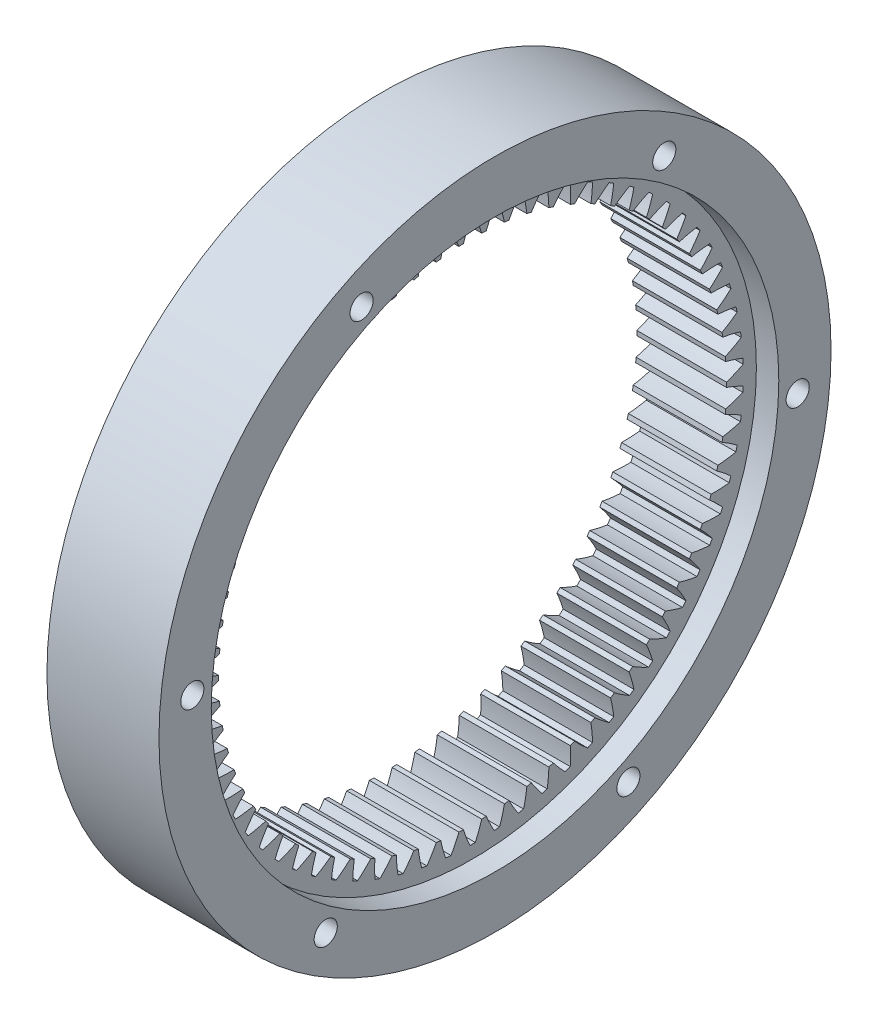
from build123d import *

# Parameters (mm, degrees)
INTERNAL_START                  = -34.130495749
INTERNAL_SPUR_GEAR_AM_OUTLINE_R = 42
INTERNAL_SPUR_GEAR_AM_DEPTH     = 12
SKETCH1_R                       = 42
SKETCH1_R_2                     = 38
BOSS_EXTRUDE1_DEPTH             = 3
SKETCH3_R                       = 45
SKETCH3_R_2                     = 42
BOSS_EXTRUDE2_DEPTH             = 15
SKETCH5_R                       = 1.55
CUT_EXTRUDE3_DEPTH              = 23
SKETCH6_R                       = 3.5
CUT_EXTRUDE4_DEPTH              = 6


# Read off the part's stored shape, not the designer's step: internal spur gear_am
with BuildPart() as part:
    # internal spur gear_am outline → internal spur gear_am (new body)
    with BuildSketch(Plane.YZ.offset(INTERNAL_START)):
        with Locations((5.209024111, 14.471263334)):
            Circle(INTERNAL_SPUR_GEAR_AM_OUTLINE_R)
        with BuildLine():
            ThreePointArc((41.458248738, 14.112494719), (40.337646202, 13.643140222), (39.187179195, 13.252666979))
            ThreePointArc((39.187179195, 13.252666979), (39.174788373, 12.945859102), (39.159627267, 12.639175639))
            ThreePointArc((39.159627267, 12.639175639), (40.27046108, 12.147147259), (41.344479787, 11.579232209))
            ThreePointArc((41.344479787, 11.579232209), (41.314088242, 11.221748747), (41.280160246, 10.864583572))
            ThreePointArc((41.280160246, 10.864583572), (40.121996313, 10.497568596), (38.941158997, 10.21179435))
            ThreePointArc((38.941158997, 10.21179435), (38.901316011, 9.907332296), (38.858725045, 9.603242482))
            ThreePointArc((38.858725045, 9.603242482), (39.920981884, 9.013620488), (40.939769395, 8.351717402))
            ThreePointArc((40.939769395, 8.351717402), (40.877455627, 7.998397341), (40.811648175, 7.64571129))
            ThreePointArc((40.811648175, 7.64571129), (39.625247701, 7.383990822), (38.423547483, 7.205216461))
            ThreePointArc((38.423547483, 7.205216461), (38.356573125, 6.90555158), (38.286895217, 6.606503766))
            ThreePointArc((38.286895217, 6.606503766), (39.292022414, 5.924035448), (40.247376051, 5.173473581))
            ThreePointArc((40.247376051, 5.173473581), (40.153641774, 4.827161646), (40.05648471, 4.48179434))
            ThreePointArc((40.05648471, 4.48179434), (38.851399893, 4.3274756), (37.638512156, 4.257140509))
            ThreePointArc((37.638512156, 4.257140509), (37.544945665, 3.964685525), (37.44874182, 3.67308747))
            ThreePointArc((37.44874182, 3.67308747), (38.388646682, 2.903267661), (39.272874499, 2.070090096))
            ThreePointArc((39.272874499, 2.070090096), (39.148474406, 1.733574587), (39.020749981, 1.39830672))
            ThreePointArc((39.020749981, 1.39830672), (37.806683457, 1.352632192), (36.59237366, 1.391302668))
            ThreePointArc((36.59237366, 1.391302668), (36.472968377, 1.108412258), (36.351013173, 0.826611737))
            ThreePointArc((36.351013173, 0.826611737), (37.218128139, -0.024361426), (38.024110854, -0.933446434))
            ThreePointArc((38.024110854, -0.933446434), (37.870046541, -1.257456092), (37.712783117, -1.57992514))
            ThreePointArc((37.712783117, -1.57992514), (36.499509835, -1.516587711), (35.293554887, -1.369223021))
            ThreePointArc((35.293554887, -1.369223021), (35.149272194, -1.64027119), (35.002547542, -1.910005285))
            ThreePointArc((35.002547542, -1.910005285), (35.789891111, -2.835280266), (36.511139424, -3.812953299))
            ThreePointArc((36.511139424, -3.812953299), (36.328651327, -4.121848371), (36.143115098, -4.428922268))
            ThreePointArc((36.143115098, -4.428922268), (34.94040362, -4.257082839), (33.752513161, -4.002210427))
            ThreePointArc((33.752513161, -4.002210427), (33.584514737, -4.259234035), (33.414201977, -4.514729963))
            ThreePointArc((33.414201977, -4.514729963), (34.115434923, -5.506856993), (34.746141768, -6.545246402))
            ThreePointArc((34.746141768, -6.545246402), (34.536699174, -6.836539847), (34.324383966, -7.125746215))
            ThreePointArc((34.324383966, -7.125746215), (33.141917819, -6.846788335), (31.981656045, -6.486460285))
            ThreePointArc((31.981656045, -6.486460285), (31.791294515, -6.727389929), (31.598764905, -6.966590588))
            ThreePointArc((31.598764905, -6.966590588), (32.208241312, -8.017581643), (32.743328608, -9.108326926))
            ThreePointArc((32.743328608, -9.108326926), (32.508617825, -9.37967342), (32.271233077, -9.64868374))
            ThreePointArc((32.271233077, -9.64868374), (31.118532782, -9.264853414), (29.995241438, -8.801970875))
            ThreePointArc((29.995241438, -8.801970875), (29.784049481, -9.024866731), (29.570853158, -9.245846217))
            ThreePointArc((29.570853158, -9.245846217), (30.08366588, -10.347239335), (30.518825418, -11.481558455))
            ThreePointArc((30.518825418, -11.481558455), (30.260736199, -11.730773274), (30.000193193, -11.977421634))
            ThreePointArc((30.000193193, -11.977421634), (28.886539616, -11.491809238), (27.809262784, -10.930099068))
            ThreePointArc((27.809262784, -10.930099068), (27.578940793, -11.13316651), (27.346794287, -11.334145627))
            ThreePointArc((27.346794287, -11.334145627), (27.758814458, -12.477073038), (28.090542589, -13.645833122))
            ThreePointArc((28.090542589, -13.645833122), (27.811152918, -13.870909737), (27.529549393, -14.093210267))
            ThreePointArc((27.529549393, -14.093210267), (26.463909018, -13.509725667), (25.441320296, -12.853710427))
            ThreePointArc((25.441320296, -12.853710427), (25.193722688, -13.035314475), (24.944495107, -13.214675056))
            ThreePointArc((24.944495107, -13.214675056), (25.252405383, -14.389934581), (25.478031228, -15.583725461))
            ThreePointArc((25.478031228, -15.583725461), (25.179590585, -15.782851686), (24.879193847, -15.979014555))
            ThreePointArc((24.879193847, -15.979014555), (23.870146583, -15.302355626), (22.910479256, -14.557317164))
            ThreePointArc((22.910479256, -14.557317164), (22.647599542, -14.715995648), (22.383297519, -14.872293589))
            ThreePointArc((22.383297519, -14.872293589), (22.584618787, -16.070422728), (22.70232574, -17.279632702))
            ThreePointArc((22.70232574, -17.279632702), (22.387236994, -17.451205291), (22.070465661, -17.61965111))
            ThreePointArc((22.070465661, -17.61965111), (21.126135763, -16.855265911), (20.237116508, -16.027202839))
            ThreePointArc((20.237116508, -16.027202839), (19.96107124, -16.161678174), (19.68382278, -16.293655055))
            ThreePointArc((19.68382278, -16.293655055), (19.77693412, -17.505007178), (19.785774473, -18.719900398))
            ThreePointArc((19.785774473, -18.719900398), (19.456574534, -18.862537949), (19.125979062, -19.00191049))
            ThreePointArc((19.125979062, -19.00191049), (18.25396972, -18.155953402), (17.442756396, -17.251532797))
            ThreePointArc((17.442756396, -17.251532797), (17.155768129, -17.360722267), (16.867805474, -17.467315487))
            ThreePointArc((16.867805474, -17.467315487), (16.851957207, -18.682137499), (16.751859783, -19.892932359))
            ThreePointArc((16.751859783, -19.892932359), (16.411199174, -20.005486438), (16.069441324, -20.114663557))
            ThreePointArc((16.069441324, -20.114663557), (15.276773444, -19.193945729), (14.549897465, -18.220449453))
            ThreePointArc((14.549897465, -18.220449453), (14.25427686, -18.303473929), (13.957918515, -18.383825263))
            ThreePointArc((13.957918515, -18.383825263), (13.833238243, -19.592336131), (13.625008967, -20.789284023))
            ThreePointArc((13.625008967, -20.789284023), (13.275630487, -20.87084841), (12.925461893, -20.948951077))
            ThreePointArc((12.925461893, -20.948951077), (12.218517571, -19.960885587), (11.581831313, -18.926151661))
            ThreePointArc((11.581831313, -18.926151661), (11.279958533, -18.982342678), (10.977590602, -19.035805183))
            ThreePointArc((10.977590602, -19.035805183), (10.745082178, -20.228274688), (10.430397589, -21.401738492))
            ThreePointArc((10.430397589, -21.401738492), (10.07511423, -21.45165648), (9.719354242, -21.498055857))
            ThreePointArc((9.719354242, -21.498055857), (9.103825377, -20.450598028), (8.562455066, -19.36295752))
            ThreePointArc((8.562455066, -19.36295752), (8.256760613, -19.391862662), (7.950817584, -19.41800589))
            ThreePointArc((7.950817584, -19.41800589), (7.612353028, -20.584832969), (7.193746783, -21.725364643))
            ThreePointArc((7.193746783, -21.725364643), (6.835419076, -21.743234321), (6.476932065, -21.757556829))
            ThreePointArc((6.476932065, -21.757556829), (5.957774534, -20.659140175), (5.516078964, -19.527350127))
            ThreePointArc((5.516078964, -19.527350127), (5.20902411, -19.528736666), (4.901969257, -19.527350127))
            ThreePointArc((4.901969257, -19.527350127), (4.460273687, -20.659140175), (3.941116156, -21.757556829))
            ThreePointArc((3.941116156, -21.757556829), (3.582629145, -21.743234321), (3.224301438, -21.725364643))
            ThreePointArc((3.224301438, -21.725364643), (2.805695193, -20.584832969), (2.467230637, -19.41800589))
            ThreePointArc((2.467230637, -19.41800589), (2.161287608, -19.391862662), (1.855593155, -19.36295752))
            ThreePointArc((1.855593155, -19.36295752), (1.314222844, -20.450598028), (0.698693979, -21.498055857))
            ThreePointArc((0.698693979, -21.498055857), (0.342933991, -21.45165648), (-0.012349368, -21.401738492))
            ThreePointArc((-0.012349368, -21.401738492), (-0.327033957, -20.228274688), (-0.559542381, -19.035805183))
            ThreePointArc((-0.559542381, -19.035805183), (-0.861910312, -18.982342678), (-1.163783092, -18.926151661))
            ThreePointArc((-1.163783092, -18.926151661), (-1.800469349, -19.960885587), (-2.507413672, -20.948951077))
            ThreePointArc((-2.507413672, -20.948951077), (-2.857582266, -20.87084841), (-3.206960746, -20.789284023))
            ThreePointArc((-3.206960746, -20.789284023), (-3.415190022, -19.592336131), (-3.539870293, -18.383825263))
            ThreePointArc((-3.539870293, -18.383825263), (-3.836228638, -18.303473929), (-4.131849243, -18.220449453))
            ThreePointArc((-4.131849243, -18.220449453), (-4.858725223, -19.193945729), (-5.651393103, -20.114663557))
            ThreePointArc((-5.651393103, -20.114663557), (-5.993150952, -20.005486438), (-6.333811561, -19.892932359))
            ThreePointArc((-6.333811561, -19.892932359), (-6.433908986, -18.682137499), (-6.449757252, -17.467315487))
            ThreePointArc((-6.449757252, -17.467315487), (-6.737719908, -17.360722267), (-7.024708175, -17.251532797))
            ThreePointArc((-7.024708175, -17.251532797), (-7.835921498, -18.155953402), (-8.70793084, -19.00191049))
            ThreePointArc((-8.70793084, -19.00191049), (-9.038526312, -18.862537949), (-9.367726251, -18.719900398))
            ThreePointArc((-9.367726251, -18.719900398), (-9.358885899, -17.505007178), (-9.265774559, -16.293655055))
            ThreePointArc((-9.265774559, -16.293655055), (-9.543023019, -16.161678174), (-9.819068287, -16.027202839))
            ThreePointArc((-9.819068287, -16.027202839), (-10.708087542, -16.855265911), (-11.65241744, -17.61965111))
            ThreePointArc((-11.65241744, -17.61965111), (-11.969188773, -17.451205291), (-12.284277519, -17.279632702))
            ThreePointArc((-12.284277519, -17.279632702), (-12.166570566, -16.070422728), (-11.965249298, -14.872293589))
            ThreePointArc((-11.965249298, -14.872293589), (-12.229551321, -14.715995648), (-12.492431035, -14.557317164))
            ThreePointArc((-12.492431035, -14.557317164), (-13.452098362, -15.302355626), (-14.461145626, -15.979014555))
            ThreePointArc((-14.461145626, -15.979014555), (-14.761542364, -15.782851686), (-15.059983007, -15.583725461))
            ThreePointArc((-15.059983007, -15.583725461), (-14.834357162, -14.389934581), (-14.526446886, -13.214675056))
            ThreePointArc((-14.526446886, -13.214675056), (-14.775674467, -13.035314474), (-15.023272075, -12.853710427))
            ThreePointArc((-15.023272075, -12.853710427), (-16.045860796, -13.509725667), (-17.111501172, -14.093210267))
            ThreePointArc((-17.111501172, -14.093210267), (-17.393104697, -13.870909737), (-17.672494368, -13.645833122))
            ThreePointArc((-17.672494368, -13.645833122), (-17.340766237, -12.477073037), (-16.928746065, -11.334145627))
            ThreePointArc((-16.928746065, -11.334145627), (-17.160892571, -11.13316651), (-17.391214563, -10.930099068))
            ThreePointArc((-17.391214563, -10.930099068), (-18.468491395, -11.491809238), (-19.582144972, -11.977421634))
            ThreePointArc((-19.582144972, -11.977421634), (-19.842687977, -11.730773274), (-20.100777196, -11.481558455))
            ThreePointArc((-20.100777196, -11.481558455), (-19.665617659, -10.347239335), (-19.152804936, -9.245846217))
            ThreePointArc((-19.152804936, -9.245846217), (-19.366001259, -9.024866731), (-19.577193217, -8.801970875))
            ThreePointArc((-19.577193217, -8.801970875), (-20.700484561, -9.264853414), (-21.853184855, -9.64868374))
            ThreePointArc((-21.853184855, -9.64868374), (-22.090569603, -9.37967342), (-22.325280386, -9.108326926))
            ThreePointArc((-22.325280386, -9.108326926), (-21.790193091, -8.017581643), (-21.180716684, -6.966590588))
            ThreePointArc((-21.180716684, -6.966590588), (-21.373246293, -6.727389929), (-21.563607824, -6.486460285))
            ThreePointArc((-21.563607824, -6.486460285), (-22.723869598, -6.846788335), (-23.906335745, -7.125746215))
            ThreePointArc((-23.906335745, -7.125746215), (-24.118650953, -6.836539846), (-24.328093547, -6.545246402))
            ThreePointArc((-24.328093547, -6.545246402), (-23.697386702, -5.506856993), (-22.996153756, -4.514729963))
            ThreePointArc((-22.996153756, -4.514729963), (-23.166466516, -4.259234035), (-23.33446494, -4.002210427))
            ThreePointArc((-23.33446494, -4.002210427), (-24.522355398, -4.257082839), (-25.725066876, -4.428922268))
            ThreePointArc((-25.725066876, -4.428922268), (-25.910603106, -4.121848371), (-26.093091203, -3.812953299))
            ThreePointArc((-26.093091203, -3.812953299), (-25.37184289, -2.835280266), (-24.58449932, -1.910005285))
            ThreePointArc((-24.58449932, -1.910005285), (-24.731223972, -1.64027119), (-24.875506666, -1.369223021))
            ThreePointArc((-24.875506666, -1.369223021), (-26.081461614, -1.516587711), (-27.294734896, -1.57992514))
            ThreePointArc((-27.294734896, -1.57992514), (-27.45199832, -1.257456092), (-27.606062632, -0.933446434))
            ThreePointArc((-27.606062632, -0.933446434), (-26.800079918, -0.024361426), (-25.932964952, 0.826611737))
            ThreePointArc((-25.932964952, 0.826611737), (-26.054920156, 1.108412258), (-26.174325439, 1.391302668))
            ThreePointArc((-26.174325439, 1.391302668), (-27.388635236, 1.352632192), (-28.60270176, 1.39830672))
            ThreePointArc((-28.60270176, 1.39830672), (-28.730426185, 1.733574587), (-28.854826278, 2.070090096))
            ThreePointArc((-28.854826278, 2.070090096), (-27.970598461, 2.903267661), (-27.030693599, 3.67308747))
            ThreePointArc((-27.030693599, 3.67308747), (-27.126897443, 3.964685526), (-27.220463935, 4.257140509))
            ThreePointArc((-27.220463935, 4.257140509), (-28.433351672, 4.3274756), (-29.638436488, 4.48179434))
            ThreePointArc((-29.638436488, 4.48179434), (-29.735593552, 4.827161646), (-29.82932783, 5.173473581))
            ThreePointArc((-29.82932783, 5.173473581), (-28.873974193, 5.924035448), (-27.868846996, 6.606503766))
            ThreePointArc((-27.868846996, 6.606503766), (-27.938524904, 6.90555158), (-28.005499261, 7.205216461))
            ThreePointArc((-28.005499261, 7.205216461), (-29.20719948, 7.383990822), (-30.393599954, 7.64571129))
            ThreePointArc((-30.393599954, 7.64571129), (-30.459407406, 7.998397341), (-30.521721174, 8.351717402))
            ThreePointArc((-30.521721174, 8.351717402), (-29.502933663, 9.013620488), (-28.440676824, 9.603242482))
            ThreePointArc((-28.440676824, 9.603242482), (-28.483267789, 9.907332296), (-28.523110775, 10.21179435))
            ThreePointArc((-28.523110775, 10.21179435), (-29.703948092, 10.497568596), (-30.862112025, 10.864583572))
            ThreePointArc((-30.862112025, 10.864583572), (-30.896040021, 11.221748747), (-30.926431566, 11.579232209))
            ThreePointArc((-30.926431566, 11.579232209), (-29.852412859, 12.147147259), (-28.741579046, 12.639175639))
            ThreePointArc((-28.741579046, 12.639175639), (-28.756740152, 12.945859102), (-28.769130974, 13.252666979))
            ThreePointArc((-28.769130974, 13.252666979), (-29.919597981, 13.643140222), (-31.040200517, 14.112494719))
            ThreePointArc((-31.040200517, 14.112494719), (-31.041975889, 14.471263334), (-31.040200517, 14.830031949))
            ThreePointArc((-31.040200517, 14.830031949), (-29.919597981, 15.299386446), (-28.769130974, 15.68985969))
            ThreePointArc((-28.769130974, 15.68985969), (-28.756740152, 15.996667566), (-28.741579046, 16.303351029))
            ThreePointArc((-28.741579046, 16.303351029), (-29.852412859, 16.79537941), (-30.926431566, 17.36329446))
            ThreePointArc((-30.926431566, 17.36329446), (-30.896040021, 17.720777921), (-30.862112025, 18.077943096))
            ThreePointArc((-30.862112025, 18.077943096), (-29.703948092, 18.444958073), (-28.523110775, 18.730732319))
            ThreePointArc((-28.523110775, 18.730732319), (-28.483267789, 19.035194372), (-28.440676824, 19.339284186))
            ThreePointArc((-28.440676824, 19.339284186), (-29.502933663, 19.928906181), (-30.521721174, 20.590809267))
            ThreePointArc((-30.521721174, 20.590809267), (-30.459407406, 20.944129328), (-30.393599954, 21.296815378))
            ThreePointArc((-30.393599954, 21.296815378), (-29.20719948, 21.558535846), (-28.005499261, 21.737310208))
            ThreePointArc((-28.005499261, 21.737310208), (-27.938524904, 22.036975089), (-27.868846996, 22.336022902))
            ThreePointArc((-27.868846996, 22.336022902), (-28.873974193, 23.018491221), (-29.82932783, 23.769053088))
            ThreePointArc((-29.82932783, 23.769053088), (-29.735593552, 24.115365023), (-29.638436488, 24.460732329))
            ThreePointArc((-29.638436488, 24.460732329), (-28.433351672, 24.615051068), (-27.220463935, 24.68538616))
            ThreePointArc((-27.220463935, 24.68538616), (-27.126897443, 24.977841143), (-27.030693599, 25.269439198))
            ThreePointArc((-27.030693599, 25.269439198), (-27.970598461, 26.039259007), (-28.854826278, 26.872436573))
            ThreePointArc((-28.854826278, 26.872436573), (-28.730426185, 27.208952082), (-28.60270176, 27.544219949))
            ThreePointArc((-28.60270176, 27.544219949), (-27.388635236, 27.589894476), (-26.174325439, 27.551224001))
            ThreePointArc((-26.174325439, 27.551224001), (-26.054920156, 27.834114411), (-25.932964952, 28.115914932))
            ThreePointArc((-25.932964952, 28.115914932), (-26.800079918, 28.966888095), (-27.606062632, 29.875973103))
            ThreePointArc((-27.606062632, 29.875973103), (-27.45199832, 30.199982761), (-27.294734896, 30.522451809))
            ThreePointArc((-27.294734896, 30.522451809), (-26.081461614, 30.45911438), (-24.875506666, 30.311749689))
            ThreePointArc((-24.875506666, 30.311749689), (-24.731223972, 30.582797858), (-24.58449932, 30.852531953))
            ThreePointArc((-24.58449932, 30.852531953), (-25.37184289, 31.777806935), (-26.093091203, 32.755479967))
            ThreePointArc((-26.093091203, 32.755479967), (-25.910603106, 33.064375039), (-25.725066876, 33.371448937))
            ThreePointArc((-25.725066876, 33.371448937), (-24.522355399, 33.199609507), (-23.33446494, 32.944737096))
            ThreePointArc((-23.33446494, 32.944737096), (-23.166466516, 33.201760704), (-22.996153756, 33.457256632))
            ThreePointArc((-22.996153756, 33.457256632), (-23.697386702, 34.449383662), (-24.328093547, 35.487773071))
            ThreePointArc((-24.328093547, 35.487773071), (-24.118650952, 35.779066515), (-23.906335745, 36.068272884))
            ThreePointArc((-23.906335745, 36.068272884), (-22.723869598, 35.789315004), (-21.563607824, 35.428986954))
            ThreePointArc((-21.563607824, 35.428986954), (-21.373246293, 35.669916597), (-21.180716684, 35.909117256))
            ThreePointArc((-21.180716684, 35.909117256), (-21.790193091, 36.960108311), (-22.325280386, 38.050853595))
            ThreePointArc((-22.325280386, 38.050853595), (-22.090569603, 38.322200088), (-21.853184855, 38.591210409))
            ThreePointArc((-21.853184855, 38.591210409), (-20.700484561, 38.207380083), (-19.577193217, 37.744497544))
            ThreePointArc((-19.577193217, 37.744497544), (-19.366001259, 37.9673934), (-19.152804936, 38.188372886))
            ThreePointArc((-19.152804936, 38.188372886), (-19.665617659, 39.289766003), (-20.100777196, 40.424085123))
            ThreePointArc((-20.100777196, 40.424085123), (-19.842687978, 40.673299943), (-19.582144972, 40.919948302))
            ThreePointArc((-19.582144972, 40.919948302), (-18.468491395, 40.434335906), (-17.391214563, 39.872625737))
            ThreePointArc((-17.391214563, 39.872625737), (-17.160892571, 40.075693178), (-16.928746065, 40.276672295))
            ThreePointArc((-16.928746065, 40.276672295), (-17.340766237, 41.419599706), (-17.672494368, 42.58835979))
            ThreePointArc((-17.672494368, 42.58835979), (-17.393104697, 42.813436405), (-17.111501172, 43.035736936))
            ThreePointArc((-17.111501172, 43.035736936), (-16.045860796, 42.452252336), (-15.023272075, 41.796237095))
            ThreePointArc((-15.023272075, 41.796237095), (-14.775674467, 41.977841143), (-14.526446886, 42.157201724))
            ThreePointArc((-14.526446886, 42.157201724), (-14.834357162, 43.332461249), (-15.059983007, 44.526252129))
            ThreePointArc((-15.059983007, 44.526252129), (-14.761542364, 44.725378355), (-14.461145626, 44.921541223))
            ThreePointArc((-14.461145626, 44.921541223), (-13.452098362, 44.244882294), (-12.492431035, 43.499843832))
            ThreePointArc((-12.492431035, 43.499843832), (-12.229551321, 43.658522317), (-11.965249298, 43.814820257))
            ThreePointArc((-11.965249298, 43.814820257), (-12.166570566, 45.012949397), (-12.284277519, 46.222159371))
            ThreePointArc((-12.284277519, 46.222159371), (-11.969188773, 46.39373196), (-11.65241744, 46.562177778))
            ThreePointArc((-11.65241744, 46.562177778), (-10.708087542, 45.797792579), (-9.819068287, 44.969729507))
            ThreePointArc((-9.819068287, 44.969729507), (-9.543023019, 45.104204843), (-9.265774559, 45.236181723))
            ThreePointArc((-9.265774559, 45.236181723), (-9.358885899, 46.447533846), (-9.367726251, 47.662427066))
            ThreePointArc((-9.367726251, 47.662427066), (-9.038526312, 47.805064617), (-8.70793084, 47.944437159))
            ThreePointArc((-8.70793084, 47.944437159), (-7.835921498, 47.098480071), (-7.024708175, 46.194059465))
            ThreePointArc((-7.024708175, 46.194059465), (-6.737719908, 46.303248936), (-6.449757252, 46.409842156))
            ThreePointArc((-6.449757252, 46.409842156), (-6.433908986, 47.624664168), (-6.333811561, 48.835459028))
            ThreePointArc((-6.333811561, 48.835459028), (-5.993150952, 48.948013106), (-5.651393103, 49.057190226))
            ThreePointArc((-5.651393103, 49.057190226), (-4.858725223, 48.136472397), (-4.131849243, 47.162976122))
            ThreePointArc((-4.131849243, 47.162976122), (-3.836228638, 47.246000598), (-3.539870293, 47.326351931))
            ThreePointArc((-3.539870293, 47.326351931), (-3.415190022, 48.534862799), (-3.206960746, 49.731810691))
            ThreePointArc((-3.206960746, 49.731810691), (-2.857582267, 49.813375079), (-2.507413672, 49.891477746))
            ThreePointArc((-2.507413672, 49.891477746), (-1.800469349, 48.903412256), (-1.163783092, 47.868678329))
            ThreePointArc((-1.163783092, 47.868678329), (-0.861910313, 47.924869347), (-0.559542381, 47.978331852))
            ThreePointArc((-0.559542381, 47.978331852), (-0.327033957, 49.170801357), (-0.012349368, 50.34426516))
            ThreePointArc((-0.012349368, 50.34426516), (0.342933991, 50.394183148), (0.698693979, 50.440582526))
            ThreePointArc((0.698693979, 50.440582526), (1.314222844, 49.393124697), (1.855593155, 48.305484189))
            ThreePointArc((1.855593155, 48.305484189), (2.161287608, 48.33438933), (2.467230637, 48.360532558))
            ThreePointArc((2.467230637, 48.360532558), (2.805695193, 49.527359637), (3.224301438, 50.667891311))
            ThreePointArc((3.224301438, 50.667891311), (3.582629145, 50.685760989), (3.941116156, 50.700083497))
            ThreePointArc((3.941116156, 50.700083497), (4.460273687, 49.601666843), (4.901969257, 48.469876796))
            ThreePointArc((4.901969257, 48.469876796), (5.209024111, 48.471263334), (5.516078964, 48.469876796))
            ThreePointArc((5.516078964, 48.469876796), (5.957774534, 49.601666843), (6.476932065, 50.700083497))
            ThreePointArc((6.476932065, 50.700083497), (6.835419076, 50.685760989), (7.193746783, 50.667891311))
            ThreePointArc((7.193746783, 50.667891311), (7.612353028, 49.527359637), (7.950817584, 48.360532558))
            ThreePointArc((7.950817584, 48.360532558), (8.256760613, 48.33438933), (8.562455066, 48.305484189))
            ThreePointArc((8.562455066, 48.305484189), (9.103825377, 49.393124697), (9.719354242, 50.440582526))
            ThreePointArc((9.719354242, 50.440582526), (10.07511423, 50.394183148), (10.430397589, 50.34426516))
            ThreePointArc((10.430397589, 50.34426516), (10.745082178, 49.170801357), (10.977590602, 47.978331852))
            ThreePointArc((10.977590602, 47.978331852), (11.279958534, 47.924869347), (11.581831313, 47.868678329))
            ThreePointArc((11.581831313, 47.868678329), (12.218517571, 48.903412255), (12.925461893, 49.891477746))
            ThreePointArc((12.925461893, 49.891477746), (13.275630488, 49.813375079), (13.625008967, 49.731810691))
            ThreePointArc((13.625008967, 49.731810691), (13.833238243, 48.534862799), (13.957918515, 47.326351931))
            ThreePointArc((13.957918515, 47.326351931), (14.25427686, 47.246000598), (14.549897465, 47.162976122))
            ThreePointArc((14.549897465, 47.162976122), (15.276773444, 48.136472397), (16.069441324, 49.057190226))
            ThreePointArc((16.069441324, 49.057190226), (16.411199174, 48.948013106), (16.751859783, 48.835459028))
            ThreePointArc((16.751859783, 48.835459028), (16.851957207, 47.624664168), (16.867805474, 46.409842156))
            ThreePointArc((16.867805474, 46.409842156), (17.15576813, 46.303248936), (17.442756396, 46.194059465))
            ThreePointArc((17.442756396, 46.194059465), (18.25396972, 47.098480071), (19.125979062, 47.944437159))
            ThreePointArc((19.125979062, 47.944437159), (19.456574533, 47.805064617), (19.785774473, 47.662427066))
            ThreePointArc((19.785774473, 47.662427066), (19.77693412, 46.447533846), (19.68382278, 45.236181723))
            ThreePointArc((19.68382278, 45.236181723), (19.961071241, 45.104204843), (20.237116508, 44.969729507))
            ThreePointArc((20.237116508, 44.969729507), (21.126135763, 45.797792579), (22.070465661, 46.562177778))
            ThreePointArc((22.070465661, 46.562177778), (22.387236994, 46.39373196), (22.70232574, 46.222159371))
            ThreePointArc((22.70232574, 46.222159371), (22.584618787, 45.012949397), (22.383297519, 43.814820257))
            ThreePointArc((22.383297519, 43.814820257), (22.647599542, 43.658522317), (22.910479256, 43.499843832))
            ThreePointArc((22.910479256, 43.499843832), (23.870146583, 44.244882294), (24.879193847, 44.921541223))
            ThreePointArc((24.879193847, 44.921541223), (25.179590585, 44.725378355), (25.478031228, 44.526252129))
            ThreePointArc((25.478031228, 44.526252129), (25.252405383, 43.332461249), (24.944495107, 42.157201724))
            ThreePointArc((24.944495107, 42.157201724), (25.193722689, 41.977841143), (25.441320296, 41.796237095))
            ThreePointArc((25.441320296, 41.796237095), (26.463909017, 42.452252336), (27.529549393, 43.035736936))
            ThreePointArc((27.529549393, 43.035736936), (27.811152918, 42.813436405), (28.090542589, 42.58835979))
            ThreePointArc((28.090542589, 42.58835979), (27.758814458, 41.419599706), (27.346794287, 40.276672295))
            ThreePointArc((27.346794287, 40.276672295), (27.578940793, 40.075693178), (27.809262784, 39.872625737))
            ThreePointArc((27.809262784, 39.872625737), (28.886539616, 40.434335906), (30.000193193, 40.919948302))
            ThreePointArc((30.000193193, 40.919948302), (30.260736199, 40.673299943), (30.518825418, 40.424085123))
            ThreePointArc((30.518825418, 40.424085123), (30.08366588, 39.289766004), (29.570853158, 38.188372886))
            ThreePointArc((29.570853158, 38.188372886), (29.784049481, 37.9673934), (29.995241438, 37.744497544))
            ThreePointArc((29.995241438, 37.744497544), (31.118532782, 38.207380083), (32.271233077, 38.591210409))
            ThreePointArc((32.271233077, 38.591210409), (32.508617825, 38.322200088), (32.743328608, 38.050853595))
            ThreePointArc((32.743328608, 38.050853595), (32.208241312, 36.960108311), (31.598764905, 35.909117256))
            ThreePointArc((31.598764905, 35.909117256), (31.791294514, 35.669916598), (31.981656045, 35.428986954))
            ThreePointArc((31.981656045, 35.428986954), (33.141917819, 35.789315004), (34.324383966, 36.068272884))
            ThreePointArc((34.324383966, 36.068272884), (34.536699174, 35.779066515), (34.746141768, 35.487773071))
            ThreePointArc((34.746141768, 35.487773071), (34.115434923, 34.449383662), (33.414201977, 33.457256632))
            ThreePointArc((33.414201977, 33.457256632), (33.584514737, 33.201760704), (33.752513161, 32.944737096))
            ThreePointArc((33.752513161, 32.944737096), (34.94040362, 33.199609507), (36.143115098, 33.371448937))
            ThreePointArc((36.143115098, 33.371448937), (36.328651327, 33.064375039), (36.511139424, 32.755479967))
            ThreePointArc((36.511139424, 32.755479967), (35.789891111, 31.777806935), (35.002547542, 30.852531953))
            ThreePointArc((35.002547542, 30.852531953), (35.149272194, 30.582797858), (35.293554887, 30.311749689))
            ThreePointArc((35.293554887, 30.311749689), (36.499509835, 30.45911438), (37.712783117, 30.522451809))
            ThreePointArc((37.712783117, 30.522451809), (37.870046541, 30.199982761), (38.024110854, 29.875973103))
            ThreePointArc((38.024110854, 29.875973103), (37.218128139, 28.966888095), (36.351013173, 28.115914932))
            ThreePointArc((36.351013173, 28.115914932), (36.472968377, 27.834114411), (36.59237366, 27.551224001))
            ThreePointArc((36.59237366, 27.551224001), (37.806683457, 27.589894476), (39.020749981, 27.544219949))
            ThreePointArc((39.020749981, 27.544219949), (39.148474406, 27.208952082), (39.272874499, 26.872436573))
            ThreePointArc((39.272874499, 26.872436573), (38.388646682, 26.039259007), (37.44874182, 25.269439198))
            ThreePointArc((37.44874182, 25.269439198), (37.544945665, 24.977841143), (37.638512156, 24.68538616))
            ThreePointArc((37.638512156, 24.68538616), (38.851399893, 24.615051068), (40.05648471, 24.460732329))
            ThreePointArc((40.05648471, 24.460732329), (40.153641774, 24.115365023), (40.247376051, 23.769053088))
            ThreePointArc((40.247376051, 23.769053088), (39.292022414, 23.018491221), (38.286895217, 22.336022902))
            ThreePointArc((38.286895217, 22.336022902), (38.356573125, 22.036975089), (38.423547483, 21.737310208))
            ThreePointArc((38.423547483, 21.737310208), (39.625247701, 21.558535846), (40.811648175, 21.296815378))
            ThreePointArc((40.811648175, 21.296815378), (40.877455627, 20.944129328), (40.939769395, 20.590809267))
            ThreePointArc((40.939769395, 20.590809267), (39.920981884, 19.928906181), (38.858725045, 19.339284186))
            ThreePointArc((38.858725045, 19.339284186), (38.901316011, 19.035194372), (38.941158997, 18.730732319))
            ThreePointArc((38.941158997, 18.730732319), (40.121996313, 18.444958073), (41.280160246, 18.077943096))
            ThreePointArc((41.280160246, 18.077943096), (41.314088242, 17.720777921), (41.344479787, 17.36329446))
            ThreePointArc((41.344479787, 17.36329446), (40.27046108, 16.79537941), (39.159627267, 16.303351029))
            ThreePointArc((39.159627267, 16.303351029), (39.174788373, 15.996667566), (39.187179195, 15.68985969))
            ThreePointArc((39.187179195, 15.68985969), (40.337646202, 15.299386446), (41.458248738, 14.830031949))
            ThreePointArc((41.458248738, 14.830031949), (41.460024111, 14.471263334), (41.458248738, 14.112494719))
        make_face(mode=Mode.SUBTRACT)
    extrude(amount=INTERNAL_SPUR_GEAR_AM_DEPTH)

    # Sketch1 → Boss-Extrude1 (add)
    with BuildSketch(Plane(origin=(-22.130495749, 0, 0), x_dir=(0, 0, -1), z_dir=(1, 0, 0))):
        with Locations(Location((-14.471263334, 5.209024111, 0), (0, 0, 180))):
            Circle(SKETCH1_R)
        with Locations((-14.471263334, 5.209024111)):
            Circle(SKETCH1_R_2, mode=Mode.SUBTRACT)
    extrude(amount=BOSS_EXTRUDE1_DEPTH)

    # Sketch3 → Boss-Extrude2 (add)
    with BuildSketch(Plane.ZY.offset(34.130495749)):
        with Locations((14.471263334, 5.209024111)):
            Circle(SKETCH3_R)
        with Locations((14.471263334, 5.209024111)):
            Circle(SKETCH3_R_2, mode=Mode.SUBTRACT)
    extrude(amount=-BOSS_EXTRUDE2_DEPTH)

    # Sketch5 → Cut-Extrude3 (cut)
    with BuildSketch(Plane.ZY.offset(34.130495749)):
        with Locations((-26.059571123, 2.437254197)):
            Circle(SKETCH5_R)
        with Locations((-3.393730736, -31.277593123)):
            Circle(SKETCH5_R)
        with Locations((37.137103722, -28.505823209)):
            Circle(SKETCH5_R)
        with Locations((55.002097791, 7.980794025)):
            Circle(SKETCH5_R)
        with Locations((32.336257404, 41.695641344)):
            Circle(SKETCH5_R)
        with Locations((-8.194577053, 38.92387143)):
            Circle(SKETCH5_R)
    extrude(amount=-CUT_EXTRUDE3_DEPTH, mode=Mode.SUBTRACT)

    # Sketch6 → Cut-Extrude4 (cut)
    with BuildSketch(Plane.ZY.offset(34.130495749)):
        with Locations((37.137103722, -28.505823209)):
            Circle(SKETCH6_R)
        with Locations((-3.393730736, -31.277593123)):
            Circle(SKETCH6_R)
        with Locations((-26.059571123, 2.437254197)):
            Circle(SKETCH6_R)
        with Locations((-8.194577053, 38.92387143)):
            Circle(SKETCH6_R)
        with Locations((32.336257404, 41.695641344)):
            Circle(SKETCH6_R)
        with Locations((55.002097791, 7.980794024)):
            Circle(SKETCH6_R)
    extrude(amount=-CUT_EXTRUDE4_DEPTH, mode=Mode.SUBTRACT)


solid = part.part
